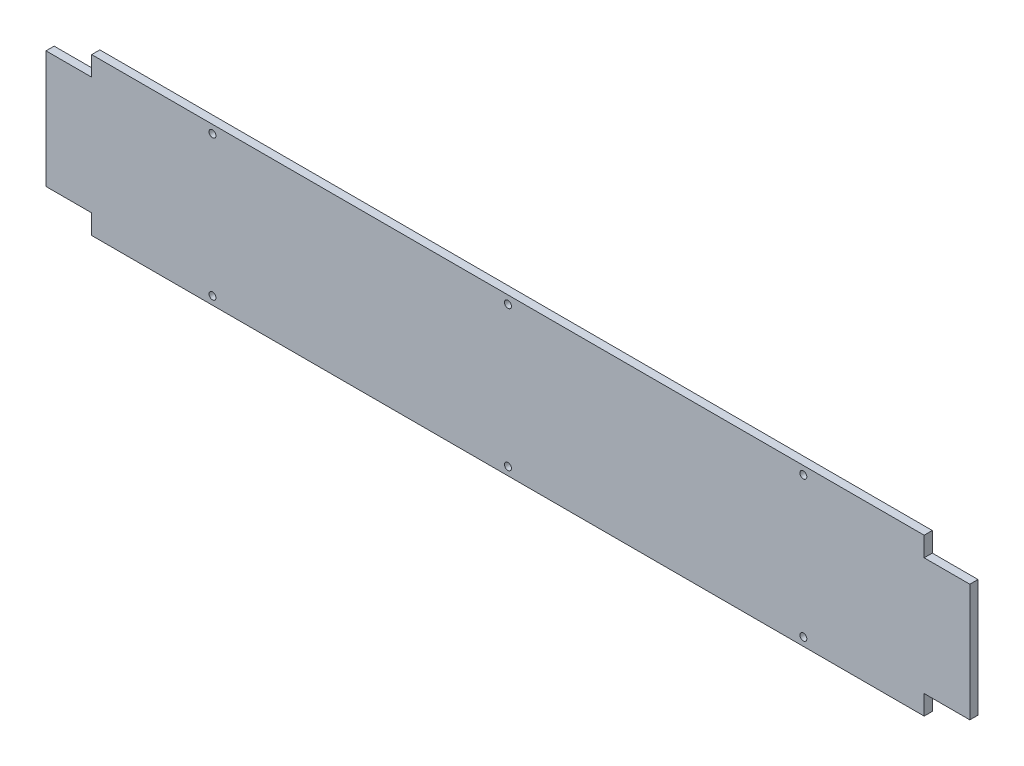
from build123d import *

# Parameters (mm, degrees)
SKETCH1_W           = 510
SKETCH1_H           = 96
BOSS_EXTRUDE1_DEPTH = 5
SKETCH2_R           = 2.125
CUT_EXTRUDE1_DEPTH  = 5
SKETCH3_W           = 28
SKETCH3_H           = 72
BOSS_EXTRUDE2_DEPTH = 5


with BuildPart() as part:
    # Sketch1 → Boss-Extrude1 (new body)
    with BuildSketch(Plane.XY):
        with Locations((255, 48)):
            Rectangle(SKETCH1_W, SKETCH1_H)
    extrude(amount=BOSS_EXTRUDE1_DEPTH)

    # Sketch2 → Cut-Extrude1 (cut)
    with BuildSketch(Plane.XY.offset(5)):
        with Locations((74, 91)):
            Circle(SKETCH2_R)
        with Locations((255, 91)):
            Circle(SKETCH2_R)
        with Locations((436, 91)):
            Circle(SKETCH2_R)
        with Locations((436, 5)):
            Circle(SKETCH2_R)
        with Locations((255, 5)):
            Circle(SKETCH2_R)
        with Locations((74, 5)):
            Circle(SKETCH2_R)
    extrude(amount=-CUT_EXTRUDE1_DEPTH, mode=Mode.SUBTRACT)

    # Sketch3 → Boss-Extrude2 (add)
    with BuildSketch(Plane.XY.offset(5)):
        with Locations((524, 48)):
            Rectangle(SKETCH3_W, SKETCH3_H)
        with Locations((-14, 48)):
            Rectangle(SKETCH3_W, SKETCH3_H)
    extrude(amount=-BOSS_EXTRUDE2_DEPTH)


solid = part.part
